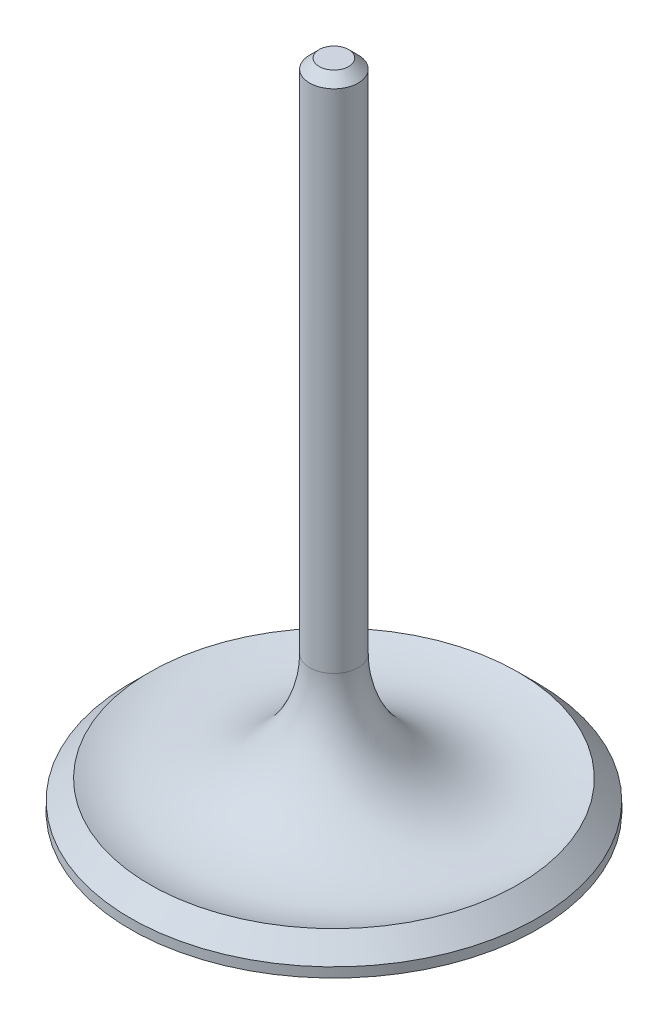
from build123d import *

# Parameters (mm, degrees)
CHAMFER1_SIZE = 1.25


with BuildPart() as part:
    # Sketch1 → Revolve1 (revolve)
    with BuildSketch(Plane(origin=(0, 0, 0), x_dir=(0, 0, -1), z_dir=(1, 0, 0))):
        with BuildLine():
            Line((0, 0), (0, 85.55))
            Line((0, 85.55), (3.18, 85.55))
            Line((3.18, 85.55), (3.18, 17.954698654))
            ThreePointArc((3.18, 17.954698654), (9.896609701, 5.315721242), (24.13, 3.81))
            Line((24.13, 3.81), (26.67, 1.27))
            Line((26.67, 1.27), (26.67, 0))
            Line((26.67, 0), (0, 0))
        make_face()
    revolve(axis=Axis((0, 0, 0), (0, 1, 0)))

    # Chamfer1
    chamfer1_edges = [part.edges().sort_by_distance(p)[0] for p in [
        (0, 85.55, 3.18),
    ]]
    chamfer(chamfer1_edges, length=CHAMFER1_SIZE)


solid = part.part
